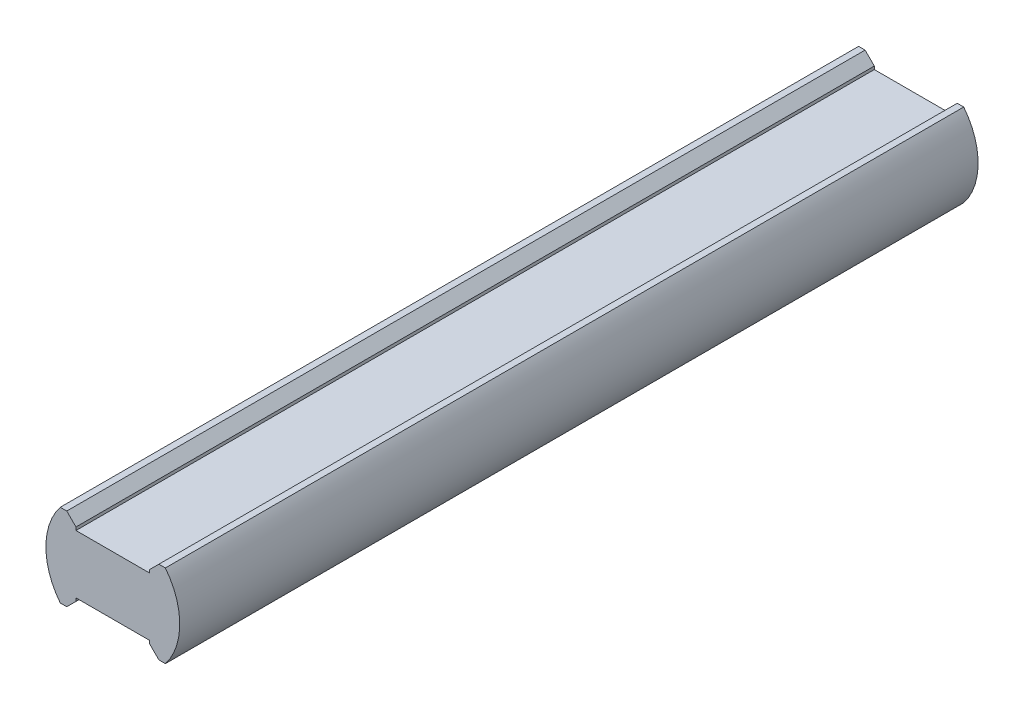
from build123d import *

# Parameters (mm, degrees)
EXTRUDE_1_DEPTH = 130


with BuildPart() as part:
    # 草圖1 → 填料-伸長1 (new body)
    with BuildSketch(Plane.XY):
        with BuildLine():
            Line((-6, 5.25), (-6, 4.75))
            Line((-6, 4.75), (6, 4.75))
            Line((6, 4.75), (6, 5.25))
            Line((6, 5.25), (7.5, 6.75))
            Line((7.5, 6.75), (8.558475332, 6.75))
            ThreePointArc((8.558475332, 6.75), (9.515520615, 5.316471332), (10.234622612, 3.75))
            ThreePointArc((10.234622612, 3.75), (10.9, 0), (10.234622612, -3.75))
            ThreePointArc((10.234622612, -3.75), (9.515520615, -5.316471332), (8.558475332, -6.75))
            Line((8.558475332, -6.75), (7.5, -6.75))
            Line((7.5, -6.75), (6, -5.25))
            Line((6, -5.25), (6, -4.75))
            Line((6, -4.75), (-6, -4.75))
            Line((-6, -4.75), (-6, -5.25))
            Line((-6, -5.25), (-7.5, -6.75))
            Line((-7.5, -6.75), (-8.558475332, -6.75))
            ThreePointArc((-8.558475332, -6.75), (-9.515520615, -5.316471332), (-10.234622612, -3.75))
            ThreePointArc((-10.234622612, -3.75), (-10.9, 0), (-10.234622612, 3.75))
            ThreePointArc((-10.234622612, 3.75), (-9.515520615, 5.316471332), (-8.558475332, 6.75))
            Line((-8.558475332, 6.75), (-7.5, 6.75))
            Line((-7.5, 6.75), (-6, 5.25))
        make_face()
    extrude(amount=EXTRUDE_1_DEPTH)


solid = part.part
